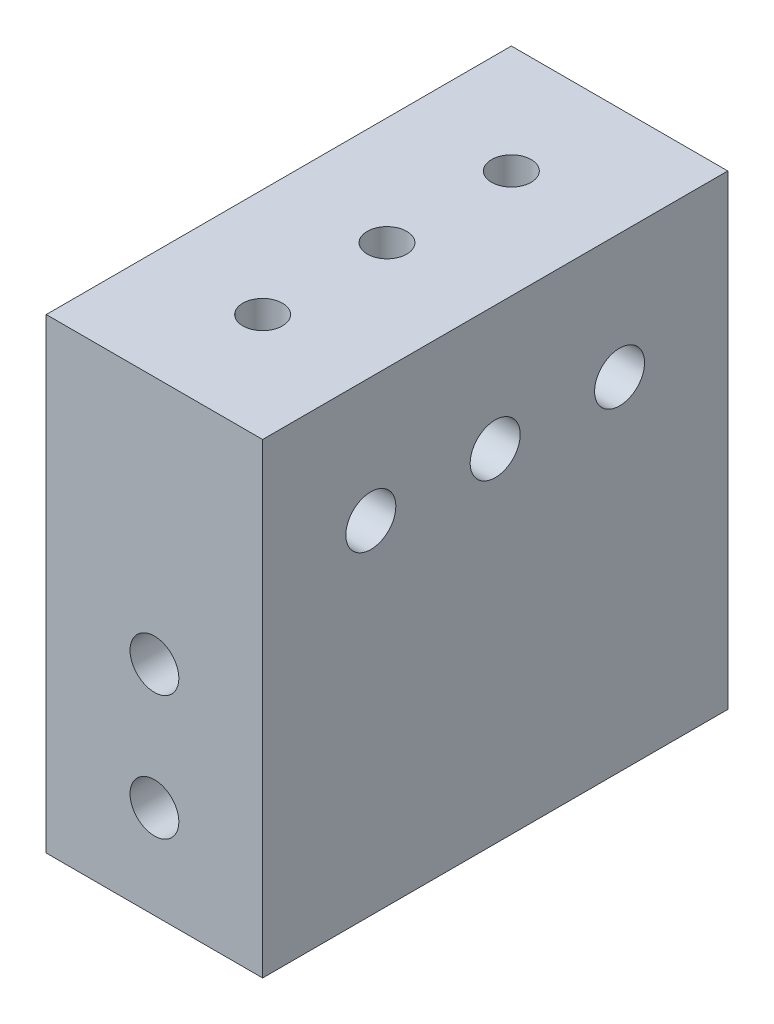
from build123d import *

# Parameters (mm, degrees)
SKETCH1_W           = 22.098
SKETCH1_H           = 47.498
BOSS_EXTRUDE1_DEPTH = 23.8125
SKETCH2_R           = 2.5527
CUT_EXTRUDE1_DEPTH  = 41.24141848
SKETCH5_R           = 2.4892
CUT_EXTRUDE2_DEPTH  = 55.269471724
SKETCH6_R           = 2.0193
CUT_EXTRUDE3_DEPTH  = 6.35


with BuildPart() as part:
    # Sketch1 → Boss-Extrude1 (new, symmetric)
    with BuildSketch(Plane(origin=(0, 0, 0), x_dir=(1, 0, 0), z_dir=(0, 1, 0))):
        Rectangle(SKETCH1_W, SKETCH1_H)
    extrude(amount=BOSS_EXTRUDE1_DEPTH, both=True)

    # Sketch2 → Cut-Extrude1 (cut, through all)
    with BuildSketch(Plane(origin=(11.049, 0, 0), x_dir=(0, 0, -1), z_dir=(1, 0, 0))):
        with Locations((-12.7, 11.1125)):
            Circle(SKETCH2_R)
        with Locations((0, 11.1125)):
            Circle(SKETCH2_R)
        with Locations((12.7, 11.1125)):
            Circle(SKETCH2_R)
    extrude(amount=-CUT_EXTRUDE1_DEPTH, mode=Mode.SUBTRACT)

    # Sketch5 → Cut-Extrude2 (cut, through all)
    with BuildSketch(Plane(origin=(0, 0, -23.749), x_dir=(-1, 0, 0), z_dir=(0, 0, -1))):
        with Locations((0, -1.5875)):
            Circle(SKETCH5_R)
        with Locations((0, -14.2875)):
            Circle(SKETCH5_R)
    extrude(amount=-CUT_EXTRUDE2_DEPTH, mode=Mode.SUBTRACT)

    # Sketch6 → Cut-Extrude3 (cut)
    with BuildSketch(Plane(origin=(0, 23.8125, 0), x_dir=(1, 0, 0), z_dir=(0, 1, 0))):
        Circle(SKETCH6_R)
        with Locations((0, 12.7)):
            Circle(SKETCH6_R)
        with Locations((0, -12.7)):
            Circle(SKETCH6_R)
    extrude(amount=-CUT_EXTRUDE3_DEPTH, mode=Mode.SUBTRACT)


solid = part.part
